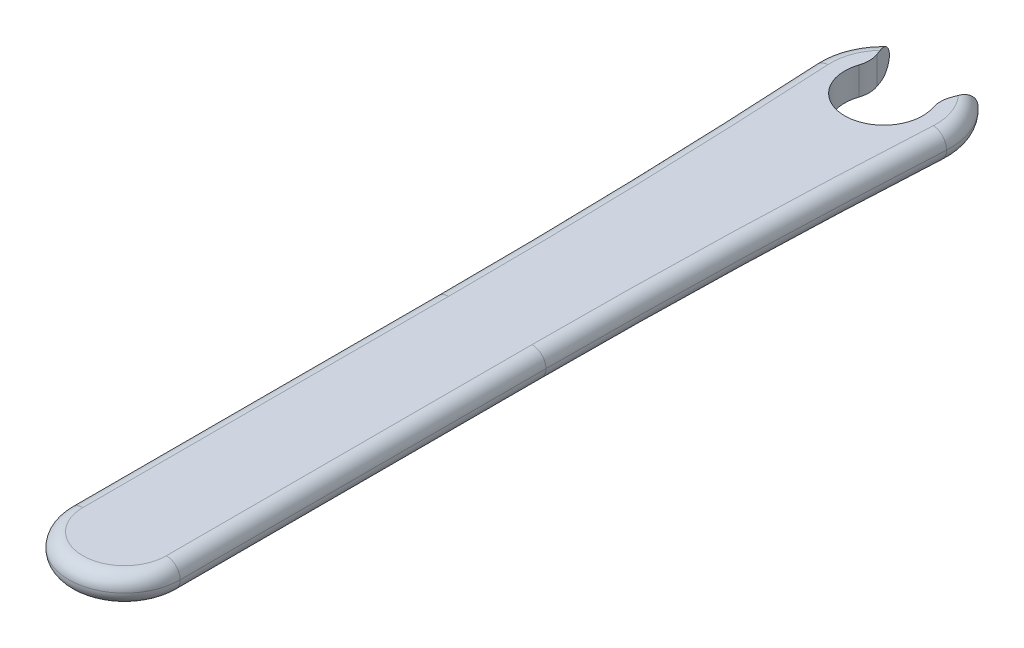
from build123d import *

# Parameters (mm, degrees)
BOSS_EXTRUDE1_DEPTH = 5
FILLET1_R           = 2.5
FILLET2_R           = 5


with BuildPart() as part:
    # Sketch1 → Boss-Extrude1 (new body)
    with BuildSketch(Plane(origin=(0, 0, 0), x_dir=(1, 0, 0), z_dir=(0, 1, 0))):
        with BuildLine():
            ThreePointArc((11.980797937, 135.715861366), (0, 124.394448725), (-11.980797937, 135.715861366))
            ThreePointArc((-11.980797937, 135.715861366), (-10.495298574, 100.729871278), (-10, 65.715861366))
            Line((-10, 65.715861366), (-10, 0))
            ThreePointArc((-10, 0), (0, -10), (10, 0))
            Line((10, 0), (10, 65.715861366))
            ThreePointArc((10, 65.715861366), (10.495298574, 100.729871278), (11.980797937, 135.715861366))
        make_face()
        with BuildLine():
            Line((-6, 140), (-7.957050212, 145.376951267))
            ThreePointArc((-7.957050212, 145.376951267), (0, 124.394448725), (7.957050212, 145.376951267))
            Line((7.957050212, 145.376951267), (6, 140))
            ThreePointArc((6, 140), (0, 129.394448725), (-6, 140))
        make_face()
    extrude(amount=BOSS_EXTRUDE1_DEPTH)

    # Fillet1
    fillet1_edges = [part.edges().sort_by_distance(p)[0] for p in [
        (11.077617601, 0, -141.008166128),
        (10.495298574, 0, -100.729871278),
        (10, 0, -32.857930683),
        (0, 0, 10),
        (-10, 0, -32.857930683),
        (-10.495298574, 0, -100.729871278),
        (11.077617601, 5, -141.008166128),
        (10.495298574, 5, -100.729871278),
        (10, 5, -32.857930683),
        (0, 5, 10),
        (-10, 5, -32.857930683),
        (-10.495298574, 5, -100.729871278),
        (-11.077617601, 0, -141.008166128),
        (-11.077617601, 5, -141.008166128),
    ]]
    fillet(fillet1_edges, radius=FILLET1_R - 0.0001)  # a hair under: the kernel refuses the full size

    # Fillet2
    fillet2_edges = [part.edges().sort_by_distance(p)[0] for p in [
        (-6, 2.5, -140),
        (6, 2.5, -140),
    ]]
    fillet(fillet2_edges, radius=FILLET2_R)


solid = part.part
